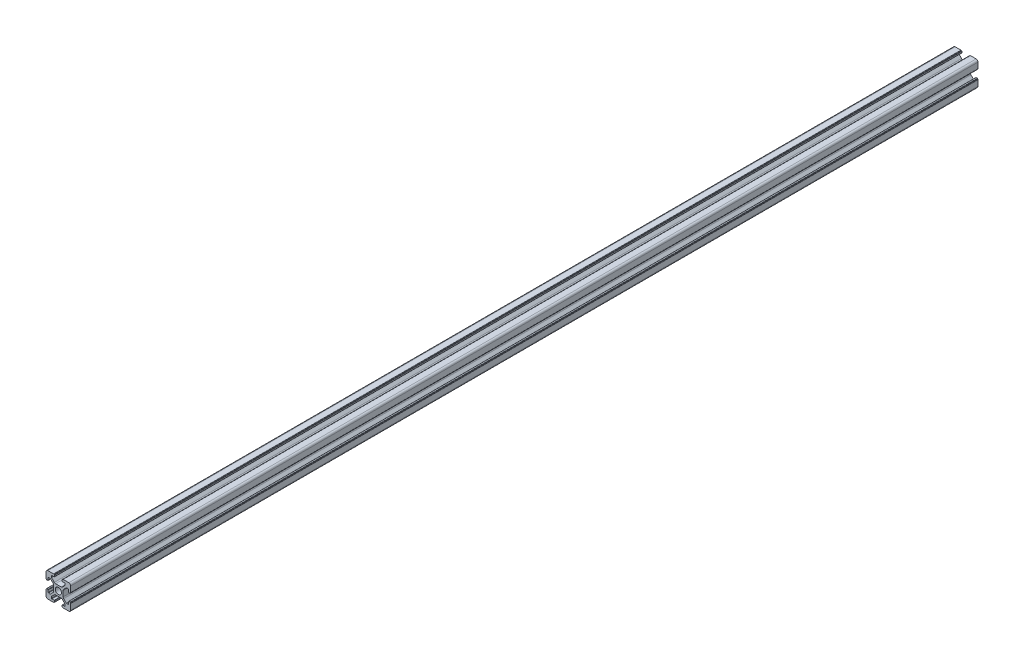
from build123d import *

# Parameters (mm, degrees)
BOSS_EXTRUDE1_DEPTH = 735
F_3DSKETCH2_R       = 2.5
CUT_EXTRUDE1_DEPTH  = 736.136088133


with BuildPart() as part:
    # Sketch1 → Boss-Extrude1 (new body)
    with BuildSketch(Plane.XY):
        with BuildLine():
            ThreePointArc((-4.339541497, 3.27832502), (-4.01438237, 2.791689997), (-3.900201668, 2.217664848))
            Line((-3.900201668, 2.217664848), (-3.900201668, -2.220777458))
            ThreePointArc((-3.900201668, -2.220777458), (-4.013982246, -2.793835668), (-4.338062619, -3.279956687))
            ThreePointArc((-4.338062619, -3.279956687), (-4.338801799, -3.280697416), (-4.339541497, -3.28143763))
            Line((-4.339541497, -3.28143763), (-6.559305445, -5.501201578))
            Line((-6.559305445, -5.501201578), (-7.918645273, -5.501201578))
            ThreePointArc((-7.918645273, -5.501201578), (-8.116635172, -5.419191476), (-8.198645273, -5.221201578))
            Line((-8.198645273, -5.221201578), (-8.198645273, -3.381201578))
            ThreePointArc((-8.198645273, -3.381201578), (-8.280655374, -3.183211679), (-8.478645273, -3.101201578))
            Line((-8.478645273, -3.101201578), (-9.418645273, -3.101201578))
            ThreePointArc((-9.418645273, -3.101201578), (-9.616635172, -3.183211679), (-9.698645273, -3.381201578))
            Line((-9.698645273, -3.381201578), (-9.698645273, -3.601201578))
            Line((-9.698645273, -3.601201578), (-9.718645273, -3.601201578))
            ThreePointArc((-9.718645273, -3.601201578), (-9.916635172, -3.683211679), (-9.998645273, -3.881201578))
            Line((-9.998645273, -3.881201578), (-9.998645273, -8.501201578))
            ThreePointArc((-9.998645273, -8.501201578), (-9.559305445, -9.561861749), (-8.498645273, -10.001201578))
            Line((-8.498645273, -10.001201578), (-3.878645273, -10.001201578))
            ThreePointArc((-3.878645273, -10.001201578), (-3.680655374, -9.919191476), (-3.598645273, -9.721201578))
            Line((-3.598645273, -9.721201578), (-3.598645273, -9.701201578))
            Line((-3.598645273, -9.701201578), (-3.378645273, -9.701201578))
            ThreePointArc((-3.378645273, -9.701201578), (-3.180655374, -9.619191476), (-3.098645273, -9.421201578))
            Line((-3.098645273, -9.421201578), (-3.098645273, -8.481201578))
            ThreePointArc((-3.098645273, -8.481201578), (-3.180655374, -8.283211679), (-3.378645273, -8.201201578))
            Line((-3.378645273, -8.201201578), (-5.218645273, -8.201201578))
            ThreePointArc((-5.218645273, -8.201201578), (-5.416635172, -8.119191476), (-5.498645273, -7.921201578))
            Line((-5.498645273, -7.921201578), (-5.498645273, -6.561861749))
            Line((-5.498645273, -6.561861749), (-3.277324929, -4.340541406))
            ThreePointArc((-3.277324929, -4.340541406), (-2.790689906, -4.015382279), (-2.216664757, -3.901201578))
            Line((-2.216664757, -3.901201578), (2.234977304, -3.899793498))
            ThreePointArc((2.234977304, -3.899793498), (2.801097117, -4.016727825), (3.280957809, -4.339061494))
            Line((3.280957809, -4.339061494), (5.502201668, -6.560305354))
            Line((5.502201668, -6.560305354), (5.502201668, -7.919645182))
            ThreePointArc((5.502201668, -7.919645182), (5.420191567, -8.117635081), (5.222201668, -8.199645182))
            Line((5.222201668, -8.199645182), (3.382201668, -8.199645182))
            ThreePointArc((3.382201668, -8.199645182), (3.18421177, -8.281655283), (3.102201668, -8.479645182))
            Line((3.102201668, -8.479645182), (3.102201668, -9.419645182))
            ThreePointArc((3.102201668, -9.419645182), (3.18421177, -9.617635081), (3.382201668, -9.699645182))
            Line((3.382201668, -9.699645182), (3.602201668, -9.699645182))
            Line((3.602201668, -9.699645182), (3.602201668, -9.719645182))
            ThreePointArc((3.602201668, -9.719645182), (3.68421177, -9.917635081), (3.882201668, -9.999645182))
            Line((3.882201668, -9.999645182), (8.502201668, -9.999645182))
            ThreePointArc((8.502201668, -9.999645182), (9.56286184, -9.560305354), (10.002201668, -8.499645182))
            Line((10.002201668, -8.499645182), (10.002201668, -3.879645182))
            ThreePointArc((10.002201668, -3.879645182), (9.920191567, -3.681655283), (9.722201668, -3.599645182))
            Line((9.722201668, -3.599645182), (9.702201668, -3.599645182))
            Line((9.702201668, -3.599645182), (9.702201668, -3.379645182))
            ThreePointArc((9.702201668, -3.379645182), (9.620191567, -3.181655283), (9.422201668, -3.099645182))
            Line((9.422201668, -3.099645182), (8.482201668, -3.099645182))
            ThreePointArc((8.482201668, -3.099645182), (8.28421177, -3.181655283), (8.202201668, -3.379645182))
            Line((8.202201668, -3.379645182), (8.202201668, -5.219645182))
            ThreePointArc((8.202201668, -5.219645182), (8.120191567, -5.417635081), (7.922201668, -5.499645182))
            Line((7.922201668, -5.499645182), (6.56286184, -5.499645182))
            Line((6.56286184, -5.499645182), (4.341541497, -3.278324838))
            ThreePointArc((4.341541497, -3.278324838), (4.01638237, -2.791689815), (3.902201668, -2.217664667))
            Line((3.902201668, -2.217664667), (3.900793589, 2.233977395))
            ThreePointArc((3.900793589, 2.233977395), (4.017727916, 2.800097207), (4.340061585, 3.2799579))
            Line((4.340061585, 3.2799579), (6.561305445, 5.501201759))
            Line((6.561305445, 5.501201759), (7.920645273, 5.501201759))
            ThreePointArc((7.920645273, 5.501201759), (8.118635172, 5.419191658), (8.200645273, 5.221201759))
            Line((8.200645273, 5.221201759), (8.200645273, 3.381201759))
            ThreePointArc((8.200645273, 3.381201759), (8.282655374, 3.183211861), (8.480645273, 3.101201759))
            Line((8.480645273, 3.101201759), (9.420645273, 3.101201759))
            ThreePointArc((9.420645273, 3.101201759), (9.618635172, 3.183211861), (9.700645273, 3.381201759))
            Line((9.700645273, 3.381201759), (9.700645273, 3.601201759))
            Line((9.700645273, 3.601201759), (9.720645273, 3.601201759))
            ThreePointArc((9.720645273, 3.601201759), (9.918635172, 3.683211861), (10.000645273, 3.881201759))
            Line((10.000645273, 3.881201759), (10.000645273, 8.501201759))
            ThreePointArc((10.000645273, 8.501201759), (9.561305445, 9.561861931), (8.500645273, 10.001201759))
            Line((8.500645273, 10.001201759), (3.880645273, 10.001201759))
            ThreePointArc((3.880645273, 10.001201759), (3.682655374, 9.919191658), (3.600645273, 9.721201759))
            Line((3.600645273, 9.721201759), (3.600645273, 9.701201759))
            Line((3.600645273, 9.701201759), (3.380645273, 9.701201759))
            ThreePointArc((3.380645273, 9.701201759), (3.182655374, 9.619191658), (3.100645273, 9.421201759))
            Line((3.100645273, 9.421201759), (3.100645273, 8.481201759))
            ThreePointArc((3.100645273, 8.481201759), (3.182655374, 8.283211861), (3.380645273, 8.201201759))
            Line((3.380645273, 8.201201759), (5.220645273, 8.201201759))
            ThreePointArc((5.220645273, 8.201201759), (5.418635172, 8.119191658), (5.500645273, 7.921201759))
            Line((5.500645273, 7.921201759), (5.500645273, 6.561861931))
            Line((5.500645273, 6.561861931), (3.279324929, 4.340541588))
            ThreePointArc((3.279324929, 4.340541588), (2.792689906, 4.015382461), (2.218664757, 3.901201759))
            Line((2.218664757, 3.901201759), (-2.232977304, 3.89979368))
            ThreePointArc((-2.232977304, 3.89979368), (-2.799097117, 4.016728006), (-3.278957809, 4.339061676))
            Line((-3.278957809, 4.339061676), (-5.500201668, 6.560305535))
            Line((-5.500201668, 6.560305535), (-5.500201668, 7.919645364))
            ThreePointArc((-5.500201668, 7.919645364), (-5.418191567, 8.117635262), (-5.220201668, 8.199645364))
            Line((-5.220201668, 8.199645364), (-3.380201668, 8.199645364))
            ThreePointArc((-3.380201668, 8.199645364), (-3.18221177, 8.281655465), (-3.100201668, 8.479645364))
            Line((-3.100201668, 8.479645364), (-3.100201668, 9.419645364))
            ThreePointArc((-3.100201668, 9.419645364), (-3.18221177, 9.617635262), (-3.380201668, 9.699645364))
            Line((-3.380201668, 9.699645364), (-3.600201668, 9.699645364))
            Line((-3.600201668, 9.699645364), (-3.600201668, 9.719645364))
            ThreePointArc((-3.600201668, 9.719645364), (-3.68221177, 9.917635262), (-3.880201668, 9.999645364))
            Line((-3.880201668, 9.999645364), (-8.500201668, 9.999645364))
            ThreePointArc((-8.500201668, 9.999645364), (-9.56086184, 9.560305535), (-10.000201668, 8.499645364))
            Line((-10.000201668, 8.499645364), (-10.000201668, 3.879645364))
            ThreePointArc((-10.000201668, 3.879645364), (-9.918191567, 3.681655465), (-9.720201668, 3.599645364))
            Line((-9.720201668, 3.599645364), (-9.700201668, 3.599645364))
            Line((-9.700201668, 3.599645364), (-9.700201668, 3.379645364))
            ThreePointArc((-9.700201668, 3.379645364), (-9.618191567, 3.181655465), (-9.420201668, 3.099645364))
            Line((-9.420201668, 3.099645364), (-8.480201668, 3.099645364))
            ThreePointArc((-8.480201668, 3.099645364), (-8.28221177, 3.181655465), (-8.200201668, 3.379645364))
            Line((-8.200201668, 3.379645364), (-8.200201668, 5.219645364))
            ThreePointArc((-8.200201668, 5.219645364), (-8.118191567, 5.417635262), (-7.920201668, 5.499645364))
            Line((-7.920201668, 5.499645364), (-6.56086184, 5.499645364))
            Line((-6.56086184, 5.499645364), (-4.339541497, 3.27832502))
        make_face()
    extrude(amount=BOSS_EXTRUDE1_DEPTH)

    # 3DSketch2 → Cut-Extrude1 (cut, through all)
    with BuildSketch(Plane.XY):
        Circle(F_3DSKETCH2_R)
    extrude(amount=CUT_EXTRUDE1_DEPTH, mode=Mode.SUBTRACT)


solid = part.part
